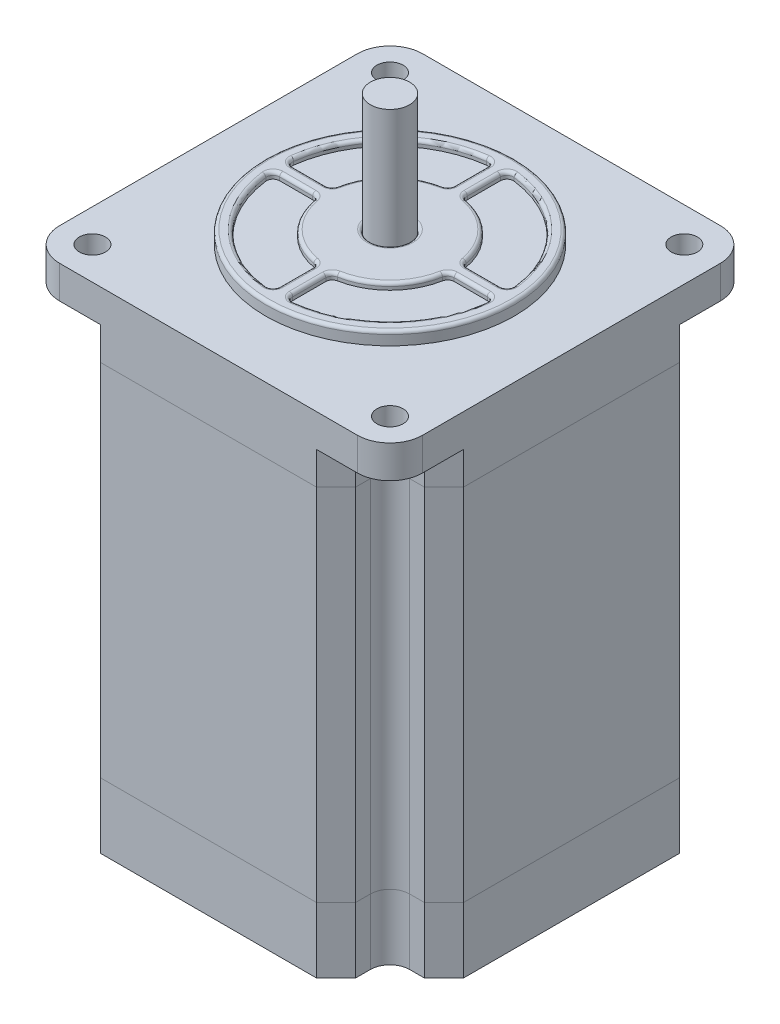
from build123d import *

# Parameters (mm, degrees)
SKETCH1_R               = 3
BOSS_EXTRUDE1_DEPTH     = 10
SKETCH2_R               = 3
BOSS_EXTRUDE2_DEPTH     = 55
SKETCH3_R               = 3
BOSS_EXTRUDE3_DEPTH     = 10
BOSS_EXTRUDE4_DEPTH     = 5
CUT_EXTRUDE1_START      = -5
SKETCH5_R               = 2
SKETCH5_R_2             = 3
CUT_EXTRUDE1_DEPTH      = 5
SKETCH8_R               = 19
BOSS_EXTRUDE5_DEPTH     = 2
CUT_EXTRUDE2_DEPTH      = 2
CUT_EXTRUDE2_DEPTH_BACK = 2
SKETCH9_R               = 3
FILLET1_R               = 0.5
SKETCH10_R              = 19
BOSS_EXTRUDE6_DEPTH     = 1
CUT_EXTRUDE3_START      = -11
SKETCH11_R              = 3
CUT_EXTRUDE3_DEPTH      = 11
SKETCH12_R              = 3
BOSS_EXTRUDE7_DEPTH     = 105


with BuildPart() as part:
    # Sketch1 → Boss-Extrude1 (new body)
    with BuildSketch(Plane(origin=(0, 0, 0), x_dir=(1, 0, 0), z_dir=(0, 1, 0))):
        with BuildLine():
            Line((0, 44.25), (3, 47.25))
            Line((3, 47.25), (5.25, 47.25))
            ThreePointArc((5.25, 47.25), (7.371320344, 48.128679656), (8.25, 50.25))
            Line((8.25, 50.25), (8.25, 52.5))
            Line((8.25, 52.5), (11.25, 55.5))
            Line((11.25, 55.5), (44.25, 55.5))
            Line((44.25, 55.5), (47.25, 52.5))
            Line((47.25, 52.5), (47.25, 50.25))
            ThreePointArc((47.25, 50.25), (48.128679656, 48.128679656), (50.25, 47.25))
            Line((50.25, 47.25), (52.5, 47.25))
            Line((52.5, 47.25), (55.5, 44.25))
            Line((55.5, 44.25), (55.5, 11.25))
            Line((55.5, 11.25), (52.5, 8.25))
            Line((52.5, 8.25), (50.25, 8.25))
            ThreePointArc((50.25, 8.25), (48.128679656, 7.371320344), (47.25, 5.25))
            Line((47.25, 5.25), (47.25, 3))
            Line((47.25, 3), (44.25, 0))
            Line((44.25, 0), (11.25, 0))
            Line((11.25, 0), (8.25, 3))
            Line((8.25, 3), (8.25, 5.25))
            ThreePointArc((8.25, 5.25), (7.371320344, 7.371320344), (5.25, 8.25))
            Line((5.25, 8.25), (3, 8.25))
            Line((3, 8.25), (0, 11.25))
            Line((0, 11.25), (0, 44.25))
        make_face()
        with Locations((27.75, 27.75)):
            Circle(SKETCH1_R, mode=Mode.SUBTRACT)
    extrude(amount=BOSS_EXTRUDE1_DEPTH)


with BuildPart() as body_2:
    # Sketch2 → Boss-Extrude2 (new body)
    with BuildSketch(Plane(origin=(0, 10, 0), x_dir=(1, 0, 0), z_dir=(0, 1, 0))):
        with BuildLine():
            Line((0, 44.25), (0, 11.25))
            Line((0, 11.25), (3, 8.25))
            Line((3, 8.25), (5.25, 8.25))
            ThreePointArc((5.25, 8.25), (7.371320344, 7.371320344), (8.25, 5.25))
            Line((8.25, 5.25), (8.25, 3))
            Line((8.25, 3), (11.25, 0))
            Line((11.25, 0), (44.25, 0))
            Line((44.25, 0), (47.25, 3))
            Line((47.25, 3), (47.25, 5.25))
            ThreePointArc((47.25, 5.25), (48.128679656, 7.371320344), (50.25, 8.25))
            Line((50.25, 8.25), (52.5, 8.25))
            Line((52.5, 8.25), (55.5, 11.25))
            Line((55.5, 11.25), (55.5, 44.25))
            Line((55.5, 44.25), (52.5, 47.25))
            Line((52.5, 47.25), (50.25, 47.25))
            ThreePointArc((50.25, 47.25), (48.128679656, 48.128679656), (47.25, 50.25))
            Line((47.25, 50.25), (47.25, 52.5))
            Line((47.25, 52.5), (44.25, 55.5))
            Line((44.25, 55.5), (11.25, 55.5))
            Line((11.25, 55.5), (8.25, 52.5))
            Line((8.25, 52.5), (8.25, 50.25))
            ThreePointArc((8.25, 50.25), (7.371320344, 48.128679656), (5.25, 47.25))
            Line((5.25, 47.25), (3, 47.25))
            Line((3, 47.25), (0, 44.25))
        make_face()
        with Locations((27.75, 27.75)):
            Circle(SKETCH2_R, mode=Mode.SUBTRACT)
    extrude(amount=BOSS_EXTRUDE2_DEPTH)


with BuildPart() as body_3:
    # Sketch3 → Boss-Extrude3 (new body)
    with BuildSketch(Plane(origin=(0, 65, 0), x_dir=(1, 0, 0), z_dir=(0, 1, 0))):
        with BuildLine():
            Line((0, 44.25), (3, 47.25))
            Line((3, 47.25), (5.25, 47.25))
            ThreePointArc((5.25, 47.25), (7.371320344, 48.128679656), (8.25, 50.25))
            Line((8.25, 50.25), (8.25, 52.5))
            Line((8.25, 52.5), (11.25, 55.5))
            Line((11.25, 55.5), (44.25, 55.5))
            Line((44.25, 55.5), (47.25, 52.5))
            Line((47.25, 52.5), (47.25, 50.25))
            ThreePointArc((47.25, 50.25), (48.128679656, 48.128679656), (50.25, 47.25))
            Line((50.25, 47.25), (52.5, 47.25))
            Line((52.5, 47.25), (55.5, 44.25))
            Line((55.5, 44.25), (55.5, 11.25))
            Line((55.5, 11.25), (52.5, 8.25))
            Line((52.5, 8.25), (50.25, 8.25))
            ThreePointArc((50.25, 8.25), (48.128679656, 7.371320344), (47.25, 5.25))
            Line((47.25, 5.25), (47.25, 3))
            Line((47.25, 3), (44.25, 0))
            Line((44.25, 0), (11.25, 0))
            Line((11.25, 0), (8.25, 3))
            Line((8.25, 3), (8.25, 5.25))
            ThreePointArc((8.25, 5.25), (7.371320344, 7.371320344), (5.25, 8.25))
            Line((5.25, 8.25), (3, 8.25))
            Line((3, 8.25), (0, 11.25))
            Line((0, 11.25), (0, 44.25))
        make_face()
        with Locations((27.75, 27.75)):
            Circle(SKETCH3_R, mode=Mode.SUBTRACT)
    extrude(amount=BOSS_EXTRUDE3_DEPTH)

    # Sketch4 → Boss-Extrude4 (add)
    with BuildSketch(Plane(origin=(0, 75, 0), x_dir=(1, 0, 0), z_dir=(0, 1, 0))):
        with BuildLine():
            Line((5, 0), (50.5, 0))
            ThreePointArc((50.5, 0), (54.035533906, 1.464466094), (55.5, 5))
            Line((55.5, 5), (55.5, 50.5))
            ThreePointArc((55.5, 50.5), (54.035533906, 54.035533906), (50.5, 55.5))
            Line((50.5, 55.5), (5, 55.5))
            ThreePointArc((5, 55.5), (1.464466094, 54.035533906), (0, 50.5))
            Line((0, 50.5), (0, 5))
            ThreePointArc((0, 5), (1.464466094, 1.464466094), (5, 0))
        make_face()
    extrude(amount=-BOSS_EXTRUDE4_DEPTH)

    # Sketch5 → Cut-Extrude1 (cut)
    with BuildSketch(Plane(origin=(0, 75, 0), x_dir=(1, 0, 0), z_dir=(0, 1, 0)).offset(CUT_EXTRUDE1_START)):
        with Locations((5, 50.5)):
            Circle(SKETCH5_R)
        with Locations((50.25, 50.25)):
            Circle(SKETCH5_R)
        with Locations((5, 5)):
            Circle(SKETCH5_R)
        with Locations((50.5, 5)):
            Circle(SKETCH5_R)
        with Locations((27.75, 27.75)):
            Circle(SKETCH5_R_2)
    extrude(amount=CUT_EXTRUDE1_DEPTH, mode=Mode.SUBTRACT)

    # Sketch8 → Boss-Extrude5 (add)
    with BuildSketch(Plane(origin=(0, 75, 0), x_dir=(1, 0, 0), z_dir=(0, 1, 0))):
        with Locations((27.75, 27.75)):
            Circle(SKETCH8_R)
        with BuildLine():
            Line((38.566653826, 28.75), (43.624507866, 28.75))
            ThreePointArc((43.624507866, 28.75), (44.374507866, 29.088562172), (44.616664608, 29.875))
            ThreePointArc((44.616664608, 29.875), (39.77081528, 39.77081528), (29.875, 44.616664608))
            ThreePointArc((29.875, 44.616664608), (29.088562172, 44.374507866), (28.75, 43.624507866))
            Line((28.75, 43.624507866), (28.75, 38.566653826))
            ThreePointArc((28.75, 38.566653826), (28.981293885, 37.927051677), (29.568181818, 37.58332166))
            ThreePointArc((29.568181818, 37.58332166), (34.821067812, 34.821067812), (37.58332166, 29.568181818))
            ThreePointArc((37.58332166, 29.568181818), (37.927051677, 28.981293885), (38.566653826, 28.75))
        make_face(mode=Mode.SUBTRACT)
        with BuildLine():
            Line((11.875492134, 28.75), (16.933346174, 28.75))
            ThreePointArc((16.933346174, 28.75), (17.572948323, 28.981293885), (17.91667834, 29.568181818))
            ThreePointArc((17.91667834, 29.568181818), (20.678932188, 34.821067812), (25.931818182, 37.58332166))
            ThreePointArc((25.931818182, 37.58332166), (26.518706115, 37.927051677), (26.75, 38.566653826))
            Line((26.75, 38.566653826), (26.75, 43.624507866))
            ThreePointArc((26.75, 43.624507866), (26.411437828, 44.374507866), (25.625, 44.616664608))
            ThreePointArc((25.625, 44.616664608), (15.72918472, 39.77081528), (10.883335392, 29.875))
            ThreePointArc((10.883335392, 29.875), (11.125492134, 29.088562172), (11.875492134, 28.75))
        make_face(mode=Mode.SUBTRACT)
        with BuildLine():
            Line((26.75, 16.933346174), (26.75, 11.875492134))
            ThreePointArc((26.75, 11.875492134), (26.411437828, 11.125492134), (25.625, 10.883335392))
            ThreePointArc((25.625, 10.883335392), (15.72918472, 15.72918472), (10.883335392, 25.625))
            ThreePointArc((10.883335392, 25.625), (11.125492134, 26.411437828), (11.875492134, 26.75))
            Line((11.875492134, 26.75), (16.933346174, 26.75))
            ThreePointArc((16.933346174, 26.75), (17.572948323, 26.518706115), (17.91667834, 25.931818182))
            ThreePointArc((17.91667834, 25.931818182), (20.678932188, 20.678932188), (25.931818182, 17.91667834))
            ThreePointArc((25.931818182, 17.91667834), (26.518706115, 17.572948323), (26.75, 16.933346174))
        make_face(mode=Mode.SUBTRACT)
        with BuildLine():
            Line((28.75, 16.933346174), (28.75, 11.875492134))
            ThreePointArc((28.75, 11.875492134), (29.088562172, 11.125492134), (29.875, 10.883335392))
            ThreePointArc((29.875, 10.883335392), (39.77081528, 15.72918472), (44.616664608, 25.625))
            ThreePointArc((44.616664608, 25.625), (44.374507866, 26.411437828), (43.624507866, 26.75))
            Line((43.624507866, 26.75), (38.566653826, 26.75))
            ThreePointArc((38.566653826, 26.75), (37.927051677, 26.518706115), (37.58332166, 25.931818182))
            ThreePointArc((37.58332166, 25.931818182), (34.821067812, 20.678932188), (29.568181818, 17.91667834))
            ThreePointArc((29.568181818, 17.91667834), (28.981293885, 17.572948323), (28.75, 16.933346174))
        make_face(mode=Mode.SUBTRACT)
    extrude(amount=BOSS_EXTRUDE5_DEPTH)

    # Sketch9 → Cut-Extrude2 (cut, two sides: drawn at the far end of the back side and taken through both)
    with BuildSketch(Plane(origin=(0, 77, 0), x_dir=(1, 0, 0), z_dir=(0, 1, 0)).offset(-CUT_EXTRUDE2_DEPTH_BACK)):
        with Locations((27.75, 27.75)):
            Circle(SKETCH9_R)
    extrude(amount=CUT_EXTRUDE2_DEPTH + CUT_EXTRUDE2_DEPTH_BACK, mode=Mode.SUBTRACT)

    # Fillet1
    fillet1_edges = [body_3.edges().sort_by_distance(p)[0] for p in [
        (26.411437828, 77, -44.374507866),
        (15.72918472, 77, -39.77081528),
        (11.125492134, 77, -29.088562172),
        (14.404419154, 77, -28.75),
        (17.572948323, 77, -28.981293885),
        (20.678932188, 77, -34.821067812),
        (26.518706115, 77, -37.927051677),
        (26.75, 77, -41.095580846),
        (29.088562172, 77, -11.125492134),
        (39.77081528, 77, -15.72918472),
        (44.374507866, 77, -26.411437828),
        (41.095580846, 77, -26.75),
        (37.927051677, 77, -26.518706115),
        (34.821067812, 77, -20.678932188),
        (28.981293885, 77, -17.572948323),
        (28.75, 77, -14.404419154),
        (8.75, 77, -27.75),
        (26.411437828, 77, -11.125492134),
        (26.75, 77, -14.404419154),
        (26.518706115, 77, -17.572948323),
        (20.678932188, 77, -20.678932188),
        (17.572948323, 77, -26.518706115),
        (14.404419154, 77, -26.75),
        (11.125492134, 77, -26.411437828),
        (15.72918472, 77, -15.72918472),
        (44.374507866, 77, -29.088562172),
        (39.77081528, 77, -39.77081528),
        (29.088562172, 77, -44.374507866),
        (28.75, 77, -41.095580846),
        (28.981293885, 77, -37.927051677),
        (34.821067812, 77, -34.821067812),
        (37.927051677, 77, -28.981293885),
        (41.095580846, 77, -28.75),
        (24.75, 77, -27.75),
    ]]
    fillet(fillet1_edges, radius=FILLET1_R)

    # Sketch10 → Boss-Extrude6 (add)
    with BuildSketch(Plane(origin=(0, 75, 0), x_dir=(1, 0, 0), z_dir=(0, 1, 0))):
        with Locations((27.75, 27.75)):
            Circle(SKETCH10_R)
    extrude(amount=BOSS_EXTRUDE6_DEPTH)

    # Sketch11 → Cut-Extrude3 (cut)
    with BuildSketch(Plane(origin=(0, 76, 0), x_dir=(1, 0, 0), z_dir=(0, 1, 0)).offset(CUT_EXTRUDE3_START)):
        with Locations((27.75, 27.75)):
            Circle(SKETCH11_R)
    extrude(amount=CUT_EXTRUDE3_DEPTH, mode=Mode.SUBTRACT)


with BuildPart() as body_4:
    # Sketch12 → Boss-Extrude7 (new body)
    with BuildSketch(Plane(origin=(0, -10, 0), x_dir=(-1, 0, 0), z_dir=(0, -1, 0))):
        with Locations((-27.75, 27.75)):
            Circle(SKETCH12_R)
    extrude(amount=-BOSS_EXTRUDE7_DEPTH)


solid = Compound([part.part, body_2.part, body_3.part, body_4.part])
